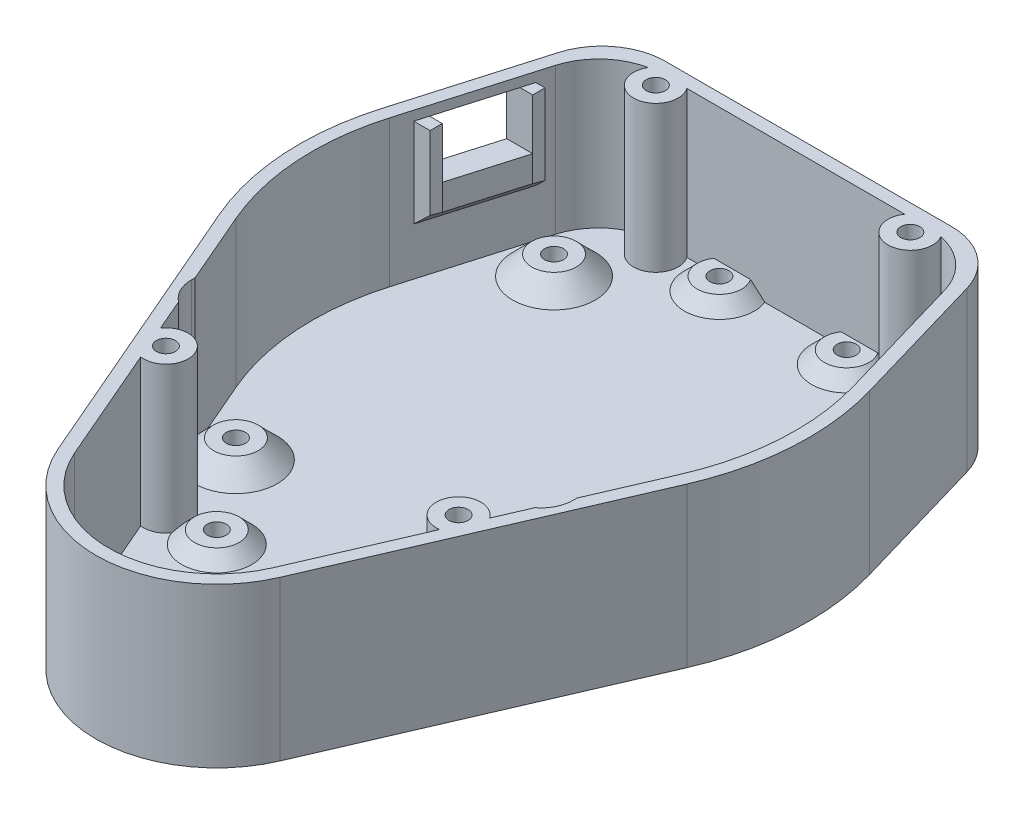
from build123d import *

# Parameters (mm, degrees)
BOSS_EXTRUDE1_DEPTH = 25
BOSS_EXTRUDE2_START = -2
BOSS_EXTRUDE2_DEPTH = 2
SKETCH3_R           = 3.5
SKETCH3_R_2         = 1.5
BOSS_EXTRUDE3_DEPTH = 3
SKETCH4_R           = 3.5
CUT_EXTRUDE1_DEPTH  = 23
SKETCH6_R           = 1.5
CUT_EXTRUDE3_DEPTH  = 5
SKETCH7_W           = 11
SKETCH7_H           = 8
SKETCH7_W_2         = 8
SKETCH7_H_2         = 5
CUT_EXTRUDE4_DEPTH  = 91.323916408
BOSS_EXTRUDE5_DEPTH = 8
BOSS_EXTRUDE6_DEPTH = 3
CHAMFER1_SIZE       = 3
SKETCH11_R          = 1.5
CUT_EXTRUDE5_DEPTH  = 10
SKETCH12_R          = 3.5
SKETCH12_R_2        = 1.5
BOSS_EXTRUDE7_DEPTH = 2
CHAMFER2_SIZE       = 2
CHAMFER3_SIZE       = 3


with BuildPart() as part:
    # Sketch1 → Boss-Extrude1 (new body)
    with BuildSketch(Plane.XZ.offset(-37.073034342)):
        with BuildLine():
            Line((-22.5, -40), (22.5, -40))
            ThreePointArc((22.5, -40), (28.5, -38), (32.1, -32.8))
            Line((32.1, -32.8), (38.4, -11.2))
            ThreePointArc((38.4, -11.2), (39.923628268, 2.470608411), (36.72611339, 15.849056604))
            Line((36.72611339, 15.849056604), (17.44490386, 60.528301887))
            ThreePointArc((17.44490386, 60.528301887), (0, 72), (-17.44490386, 60.528301887))
            Line((-17.44490386, 60.528301887), (-36.72611339, 15.849056604))
            ThreePointArc((-36.72611339, 15.849056604), (-39.923628268, 2.470608411), (-38.4, -11.2))
            Line((-38.4, -11.2), (-32.1, -32.8))
            ThreePointArc((-32.1, -32.8), (-28.5, -38), (-22.5, -40))
        make_face()
        with BuildLine():
            Line((-17.127718677, -38), (17.127718677, -38))
            ThreePointArc((17.127718677, -38), (19.879318075, -32.502081208), (23.003291752, -37.797286469))
            ThreePointArc((23.003291752, -37.797286469), (27.774924306, -35.355297455), (30.6, -30.8))
            Line((30.6, -30.8), (36.48, -10.64))
            ThreePointArc((36.48, -10.64), (37.927446855, 2.347077991), (34.889807721, 15.056603774))
            Line((34.889807721, 15.056603774), (25.859567427, 35.981863698))
            ThreePointArc((25.859567427, 35.981863698), (19.786465078, 36.613207547), (23.493308255, 41.465060889))
            Line((23.493308255, 41.465060889), (15.608598191, 59.735849057))
            ThreePointArc((15.608598191, 59.735849057), (0, 70), (-15.608598191, 59.735849057))
            Line((-15.608598191, 59.735849057), (-23.493308255, 41.465060889))
            ThreePointArc((-23.493308255, 41.465060889), (-19.786465078, 36.613207547), (-25.859567427, 35.981863698))
            Line((-25.859567427, 35.981863698), (-34.889807721, 15.056603774))
            ThreePointArc((-34.889807721, 15.056603774), (-37.927446855, 2.347077991), (-36.48, -10.64))
            Line((-36.48, -10.64), (-30.6, -30.8))
            ThreePointArc((-30.6, -30.8), (-27.774924306, -35.355297455), (-23.003291752, -37.797286469))
            ThreePointArc((-23.003291752, -37.797286469), (-19.879318075, -32.502081208), (-17.127718677, -38))
        make_face(mode=Mode.SUBTRACT)
    extrude(amount=BOSS_EXTRUDE1_DEPTH)

    # Sketch2 → Boss-Extrude2 (add)
    with BuildSketch(Plane.XZ.offset(-12.073034342).offset(BOSS_EXTRUDE2_START)):
        with BuildLine():
            Line((-38.4, -11.2), (-32.1, -32.8))
            ThreePointArc((-32.1, -32.8), (-28.5, -38), (-22.5, -40))
            Line((-22.5, -40), (22.5, -40))
            ThreePointArc((22.5, -40), (28.5, -38), (32.1, -32.8))
            Line((32.1, -32.8), (38.4, -11.2))
            ThreePointArc((38.4, -11.2), (39.923628268, 2.470608411), (36.72611339, 15.849056604))
            Line((36.72611339, 15.849056604), (17.44490386, 60.528301887))
            ThreePointArc((17.44490386, 60.528301887), (0, 72), (-17.44490386, 60.528301887))
            Line((-17.44490386, 60.528301887), (-36.72611339, 15.849056604))
            ThreePointArc((-36.72611339, 15.849056604), (-39.923628268, 2.470608411), (-38.4, -11.2))
        make_face()
    extrude(amount=BOSS_EXTRUDE2_DEPTH)

    # Sketch3 → Boss-Extrude3 (add)
    # profile 1 of 4: a face of its own
    with BuildSketch(Plane(origin=(0, 14.073034342, 0), x_dir=(1, 0, 0), z_dir=(0, 1, 0))):
        with Locations((25, -25)):
            Circle(SKETCH3_R)
        with Locations(Location((25, -25, 0), (0, 0, 180))):
            Circle(SKETCH3_R_2, mode=Mode.SUBTRACT)
    # profile 2 of 4: a face of its own
    with BuildSketch(Plane(origin=(0, 14.073034342, 0), x_dir=(1, 0, 0), z_dir=(0, 1, 0))):
        with Locations((25, 25)):
            Circle(SKETCH3_R)
        with Locations(Location((25, 25, 0), (0, 0, 180))):
            Circle(SKETCH3_R_2, mode=Mode.SUBTRACT)
    # profile 3 of 4: a face of its own
    with BuildSketch(Plane(origin=(0, 14.073034342, 0), x_dir=(1, 0, 0), z_dir=(0, 1, 0))):
        with Locations((-25, 25)):
            Circle(SKETCH3_R)
        with Locations(Location((-25, 25, 0), (0, 0, 180))):
            Circle(SKETCH3_R_2, mode=Mode.SUBTRACT)
    # profile 4 of 4: a face of its own
    with BuildSketch(Plane(origin=(0, 14.073034342, 0), x_dir=(1, 0, 0), z_dir=(0, 1, 0))):
        with Locations((-25, -25)):
            Circle(SKETCH3_R)
        with Locations(Location((-25, -25, 0), (0, 0, 180))):
            Circle(SKETCH3_R_2, mode=Mode.SUBTRACT)
    extrude(amount=BOSS_EXTRUDE3_DEPTH)

    # Sketch4 → Cut-Extrude1 (cut)
    # profile 1 of 2: a face of its own
    with BuildSketch(Plane(origin=(0, 14.073034342, 0), x_dir=(1, 0, 0), z_dir=(0, 1, 0))):
        with BuildLine():
            Line((30, -26.387475844), (28.014037499, -30.989433288))
            ThreePointArc((28.014037499, -30.989433288), (29.476057836, -29.228206959), (30, -27))
            Line((30, -27), (30, -26.387475844))
        make_face()
    # profile 2 of 2: a face of its own
    with BuildSketch(Plane(origin=(0, 14.073034342, 0), x_dir=(1, 0, 0), z_dir=(0, 1, 0))):
        with BuildLine():
            ThreePointArc((-30, -27), (-28.535533906, -30.535533906), (-25, -32))
            Line((-25, -32), (25, -32))
            ThreePointArc((25, -32), (26.589470598, -31.740631099), (28.014037499, -30.989433288))
            Line((28.014037499, -30.989433288), (30, -26.387475844))
            Line((30, -26.387475844), (30, 27))
            ThreePointArc((30, 27), (28.535533906, 30.535533906), (25, 32))
            Line((25, 32), (-25, 32))
            ThreePointArc((-25, 32), (-28.535533906, 30.535533906), (-30, 27))
            Line((-30, 27), (-30, -27))
        make_face()
        with Locations((-25, -25)):
            Circle(SKETCH4_R, mode=Mode.SUBTRACT)
        with Locations((25, -25)):
            Circle(SKETCH4_R, mode=Mode.SUBTRACT)
        with Locations((-25, 25)):
            Circle(SKETCH4_R, mode=Mode.SUBTRACT)
        with Locations((25, 25)):
            Circle(SKETCH4_R, mode=Mode.SUBTRACT)
    extrude(amount=CUT_EXTRUDE1_DEPTH, mode=Mode.SUBTRACT)

    # Sketch6 → Cut-Extrude3 (cut)
    with BuildSketch(Plane(origin=(0, 37.073034342, 0), x_dir=(1, 0, 0), z_dir=(0, 1, 0))):
        with Locations(Location((-20, 36, 0), (0, 0, 270))):
            Circle(SKETCH6_R)
        with Locations(Location((20, 36, 0), (0, 0, 270))):
            Circle(SKETCH6_R)
        with Locations(Location((23, -38, 0), (0, 0, 270))):
            Circle(SKETCH6_R)
        with Locations(Location((-23, -38, 0), (0, 0, 270))):
            Circle(SKETCH6_R)
    extrude(amount=-CUT_EXTRUDE3_DEPTH, mode=Mode.SUBTRACT)

    # Sketch7 → Cut-Extrude4 (cut, through all)
    # profile 1 of 2: a face of its own
    with BuildSketch(Plane(origin=(0, 0, 0), x_dir=(0, 0, -1), z_dir=(1, 0, 0))):
        with Locations((21, 31.573034342)):
            Rectangle(SKETCH7_W, SKETCH7_H)
        with Locations((21, 31.573034342)):
            Rectangle(SKETCH7_W_2, SKETCH7_H_2, mode=Mode.SUBTRACT)
    # profile 2 of 2: a face of its own
    with BuildSketch(Plane(origin=(0, 0, 0), x_dir=(0, 0, -1), z_dir=(1, 0, 0))):
        with Locations((21, 31.573034342)):
            Rectangle(SKETCH7_W_2, SKETCH7_H_2)
    extrude(amount=-CUT_EXTRUDE4_DEPTH, mode=Mode.SUBTRACT)

    # Sketch9 → Boss-Extrude5 (add)
    with BuildSketch(Plane(origin=(0, 27.573034342, 0), x_dir=(1, 0, 0), z_dir=(0, 1, 0))):
        Polygon((-33.0625, 13.58), (-33.0625, 15.5), (-35.0625, 15.5), (-35.6225, 13.58), align=None)
        Polygon((-29.854166667, 28.42), (-31.294166667, 28.42), (-31.854166667, 26.5), (-29.854166667, 26.5), align=None)
    extrude(amount=BOSS_EXTRUDE5_DEPTH)

    # Sketch10 → Boss-Extrude6 (add)
    with BuildSketch(Plane.XZ.offset(-27.573034342)):
        Polygon((-35.6225, -13.58), (-31.294166667, -28.42), (-29.854166667, -28.42), (-29.854166667, -26.5), (-33.0625, -15.5), (-33.0625, -13.58), align=None)
    extrude(amount=BOSS_EXTRUDE6_DEPTH)

    # Chamfer1
    # the kernel refuses this chamfer: 3 mm, written as the material it adds along each edge
    with BuildSketch(Plane(origin=(-37.78271371, 24.573034342, -6.173552995), x_dir=(0.9596370402348446, 0.02749587661058677, 0.2798941367351632), z_dir=(0.2800000000000002, 0, -0.96))) as chamfer1_piece_1_section:
        Polygon((CHAMFER1_SIZE * 0.999621916911, CHAMFER1_SIZE * 0.0274958766106), (-CHAMFER1_SIZE * 0.0274958766106, CHAMFER1_SIZE * 0.999621916911), (0, 0), align=None)
    chamfer1_piece_1 = extrude(amount=30.888431261, mode=Mode.PRIVATE)
    chamfer1_piece_1 = split(chamfer1_piece_1, bisect_by=Plane(origin=(-33.0625, 24.155030607, -14.247780946), z_dir=(-1, 0, 0)), keep=Keep.TOP, mode=Mode.PRIVATE)
    chamfer1_piece_1 = split(chamfer1_piece_1, bisect_by=Plane(origin=(-33.414366406, 24.155030607, -14.293600894), z_dir=(0.9599999999999999, 0, 0.2800000000000006)), keep=Keep.TOP, mode=Mode.PRIVATE)
    chamfer1_piece_1 = split(chamfer1_piece_1, bisect_by=Plane(origin=(-33.257269443, 24.155030607, -13.58), z_dir=(0, 0, -1)), keep=Keep.TOP, mode=Mode.PRIVATE)
    add(chamfer1_piece_1)
    with BuildSketch(Plane(origin=(-37.78271371, 24.573034342, -6.173552995), x_dir=(0.9596370402348446, 0.02749587661058677, 0.2798941367351632), z_dir=(0.2800000000000002, 0, -0.96))) as chamfer1_piece_2_section:
        Polygon((CHAMFER1_SIZE * 0.999621916911, CHAMFER1_SIZE * 0.0274958766106), (-CHAMFER1_SIZE * 0.0274958766106, CHAMFER1_SIZE * 0.999621916911), (0, 0), align=None)
    chamfer1_piece_2 = extrude(amount=30.888431261, mode=Mode.PRIVATE)
    chamfer1_piece_2 = split(chamfer1_piece_2, bisect_by=Plane(origin=(-33.0625, 23.368164353, -16.922113673), z_dir=(-1, 0, 0)), keep=Keep.TOP, mode=Mode.PRIVATE)
    chamfer1_piece_2 = split(chamfer1_piece_2, bisect_by=Plane(origin=(-32.756658844, 23.368164353, -16.548598249), z_dir=(-0.9599999999999999, 0, -0.2800000000000006)), keep=Keep.TOP, mode=Mode.PRIVATE)
    chamfer1_piece_2 = split(chamfer1_piece_2, bisect_by=Plane(origin=(-34.037283155, 23.368164353, -13.58), z_dir=(0, 0, -1)), keep=Keep.TOP, mode=Mode.PRIVATE)
    add(chamfer1_piece_2)
    with BuildSketch(Plane(origin=(-37.78271371, 24.573034342, -6.173552995), x_dir=(0.9596370402348446, 0.02749587661058677, 0.2798941367351632), z_dir=(0.2800000000000002, 0, -0.96))) as chamfer1_piece_3_section:
        Polygon((CHAMFER1_SIZE * 0.999621916911, CHAMFER1_SIZE * 0.0274958766106), (-CHAMFER1_SIZE * 0.0274958766106, CHAMFER1_SIZE * 0.999621916911), (0, 0), align=None)
    chamfer1_piece_3 = extrude(amount=30.888431261, mode=Mode.PRIVATE)
    chamfer1_piece_3 = split(chamfer1_piece_3, bisect_by=Plane(origin=(-33.0625, 23.528567842, -23.718008697), z_dir=(1, 0, 0)), keep=Keep.TOP, mode=Mode.PRIVATE)
    chamfer1_piece_3 = split(chamfer1_piece_3, bisect_by=Plane(origin=(-31.750809391, 23.528567842, -28.42), z_dir=(0, 0, 1)), keep=Keep.TOP, mode=Mode.PRIVATE)
    chamfer1_piece_3 = split(chamfer1_piece_3, bisect_by=Plane(origin=(-29.854166667, 23.528567842, -23.718008697), z_dir=(-1, 0, 0)), keep=Keep.TOP, mode=Mode.PRIVATE)
    chamfer1_piece_3 = split(chamfer1_piece_3, bisect_by=Plane(origin=(-30.750662718, 23.528567842, -23.426299251), z_dir=(-0.9599999999999999, 0, -0.2800000000000006)), keep=Keep.TOP, mode=Mode.PRIVATE)
    add(chamfer1_piece_3)

    # Sketch11 → Cut-Extrude5 (cut)
    with BuildSketch(Plane.XZ.offset(-12.073034342)):
        with Locations(Location((10, -36, 0), (0, 0, 270))):
            Circle(SKETCH11_R)
        with Locations(Location((-10, -36, 0), (0, 0, 270))):
            Circle(SKETCH11_R)
        with Locations(Location((15, 38, 0), (0, 0, 270))):
            Circle(SKETCH11_R)
        with Locations(Location((-15, 38, 0), (0, 0, 270))):
            Circle(SKETCH11_R)
    extrude(amount=-CUT_EXTRUDE5_DEPTH, mode=Mode.SUBTRACT)

    # Sketch12 → Boss-Extrude7 (add)
    # profile 1 of 4: a face of its own
    with BuildSketch(Plane(origin=(0, 14.073034342, 0), x_dir=(1, 0, 0), z_dir=(0, 1, 0))):
        with Locations((-15, -38)):
            Circle(SKETCH12_R)
        with Locations(Location((-15, -38, 0), (0, 0, 90))):
            Circle(SKETCH12_R_2, mode=Mode.SUBTRACT)
    # profile 2 of 4: a face of its own
    with BuildSketch(Plane(origin=(0, 14.073034342, 0), x_dir=(1, 0, 0), z_dir=(0, 1, 0))):
        with Locations((15, -38)):
            Circle(SKETCH12_R)
        with Locations(Location((15, -38, 0), (0, 0, 90))):
            Circle(SKETCH12_R_2, mode=Mode.SUBTRACT)
    # profile 3 of 4: a face of its own
    with BuildSketch(Plane(origin=(0, 14.073034342, 0), x_dir=(1, 0, 0), z_dir=(0, 1, 0))):
        with Locations((10, 36)):
            Circle(SKETCH12_R)
        with Locations(Location((10, 36, 0), (0, 0, 90))):
            Circle(SKETCH12_R_2, mode=Mode.SUBTRACT)
    # profile 4 of 4: a face of its own
    with BuildSketch(Plane(origin=(0, 14.073034342, 0), x_dir=(1, 0, 0), z_dir=(0, 1, 0))):
        with Locations((-10, 36)):
            Circle(SKETCH12_R)
        with Locations(Location((-10, 36, 0), (0, 0, 90))):
            Circle(SKETCH12_R_2, mode=Mode.SUBTRACT)
    extrude(amount=BOSS_EXTRUDE7_DEPTH)

    # Chamfer2
    # the kernel refuses this chamfer: 2 mm, written as the material it adds along each edge
    with BuildSketch(Plane(origin=(-15, 14.073034342, 38), x_dir=(1, 0, 0), z_dir=(0, 0, 1))) as chamfer2_piece_1:
        Polygon((3.5 + CHAMFER2_SIZE, 0), (3.5, CHAMFER2_SIZE), (3.5, 0), align=None)
    revolve(axis=Axis((-15, 14.073034342, 38), (0, 1, 0)))
    with BuildSketch(Plane(origin=(15, 14.073034342, 38), x_dir=(1, 0, 0), z_dir=(0, 0, 1))) as chamfer2_piece_2:
        Polygon((3.5, CHAMFER2_SIZE), (3.5 + CHAMFER2_SIZE, 0), (3.5, 0), align=None)
    revolve(axis=Axis((15, 14.073034342, 38), (0, 1, 0)))
    with BuildSketch(Plane(origin=(10, 14.073034342, -36), x_dir=(0.003141587485879528, -1.0150610510858574e-15, -0.9999950652018582), z_dir=(-0.9999950652018582, 0, -0.003141587485879528))) as chamfer2_piece_3_section:
        Polygon((3.5 + CHAMFER2_SIZE, 0), (3.5, -CHAMFER2_SIZE), (3.5, 0), align=None)
    chamfer2_piece_3 = revolve(axis=Axis((10, 14.073034342, -36), (0, -1, 0)), revolution_arc=359.64, mode=Mode.PRIVATE)
    chamfer2_piece_3 = split(chamfer2_piece_3, bisect_by=Plane(origin=(10, 15.050005962, -40), z_dir=(0, 0, 1)), keep=Keep.TOP, mode=Mode.PRIVATE)
    add(chamfer2_piece_3)
    with BuildSketch(Plane(origin=(-10, 14.073034342, -36), x_dir=(0.0031415874858790205, -1.0150610510858574e-15, -0.9999950652018582), z_dir=(-0.9999950652018582, 0, -0.0031415874858790205))) as chamfer2_piece_4_section:
        Polygon((3.5 + CHAMFER2_SIZE, 0), (3.5, -CHAMFER2_SIZE), (3.5, 0), align=None)
    chamfer2_piece_4 = revolve(axis=Axis((-10, 14.073034342, -36), (0, -1, 0)), revolution_arc=359.64, mode=Mode.PRIVATE)
    chamfer2_piece_4 = split(chamfer2_piece_4, bisect_by=Plane(origin=(-10, 15.050005962, -40), z_dir=(0, 0, 1)), keep=Keep.TOP, mode=Mode.PRIVATE)
    add(chamfer2_piece_4)

    # Chamfer3
    # the kernel refuses this chamfer: 3 mm, written as the material it adds along each edge
    with BuildSketch(Plane(origin=(25, 14.073034342, 25), x_dir=(1, 0, 0), z_dir=(0, 0, 1))) as chamfer3_piece_1_section:
        Polygon((3.5 + CHAMFER3_SIZE, 0), (3.5, CHAMFER3_SIZE), (3.5, 0), align=None)
    chamfer3_piece_1 = revolve(axis=Axis((25, 14.073034342, 25), (0, 1, 0)), mode=Mode.PRIVATE)
    chamfer3_piece_1 = split(chamfer3_piece_1, bisect_by=Plane(origin=(19.994246695, 17.073034342, 25), z_dir=(0, -1, 0)), keep=Keep.TOP, mode=Mode.PRIVATE)
    add(chamfer3_piece_1)
    with BuildSketch(Plane(origin=(25, 14.073034342, -25), x_dir=(1, 0, 0), z_dir=(0, 0, 1))) as chamfer3_piece_2_section:
        Polygon((3.5 + CHAMFER3_SIZE, 0), (3.5, CHAMFER3_SIZE), (3.5, 0), align=None)
    chamfer3_piece_2 = revolve(axis=Axis((25, 14.073034342, -25), (0, 1, 0)), mode=Mode.PRIVATE)
    chamfer3_piece_2 = split(chamfer3_piece_2, bisect_by=Plane(origin=(19.994246691, 17.073034342, -25), z_dir=(0, -1, 0)), keep=Keep.TOP, mode=Mode.PRIVATE)
    add(chamfer3_piece_2)
    with BuildSketch(Plane(origin=(-25, 14.073034342, -25), x_dir=(1, 0, 0), z_dir=(0, 0, 1))) as chamfer3_piece_3_section:
        Polygon((3.5 + CHAMFER3_SIZE, 0), (3.5, CHAMFER3_SIZE), (3.5, 0), align=None)
    chamfer3_piece_3 = revolve(axis=Axis((-25, 14.073034342, -25), (0, 1, 0)), mode=Mode.PRIVATE)
    chamfer3_piece_3 = split(chamfer3_piece_3, bisect_by=Plane(origin=(-30.005753306, 17.073034342, -25), z_dir=(0, -1, 0)), keep=Keep.TOP, mode=Mode.PRIVATE)
    add(chamfer3_piece_3)
    with BuildSketch(Plane(origin=(-25, 14.073034342, 25), x_dir=(1, 0, 0), z_dir=(0, 0, 1))) as chamfer3_piece_4_section:
        Polygon((3.5 + CHAMFER3_SIZE, 0), (3.5, CHAMFER3_SIZE), (3.5, 0), align=None)
    chamfer3_piece_4 = revolve(axis=Axis((-25, 14.073034342, 25), (0, 1, 0)), mode=Mode.PRIVATE)
    chamfer3_piece_4 = split(chamfer3_piece_4, bisect_by=Plane(origin=(-30.00575331, 17.073034342, 25), z_dir=(0, -1, 0)), keep=Keep.TOP, mode=Mode.PRIVATE)
    add(chamfer3_piece_4)


solid = part.part
